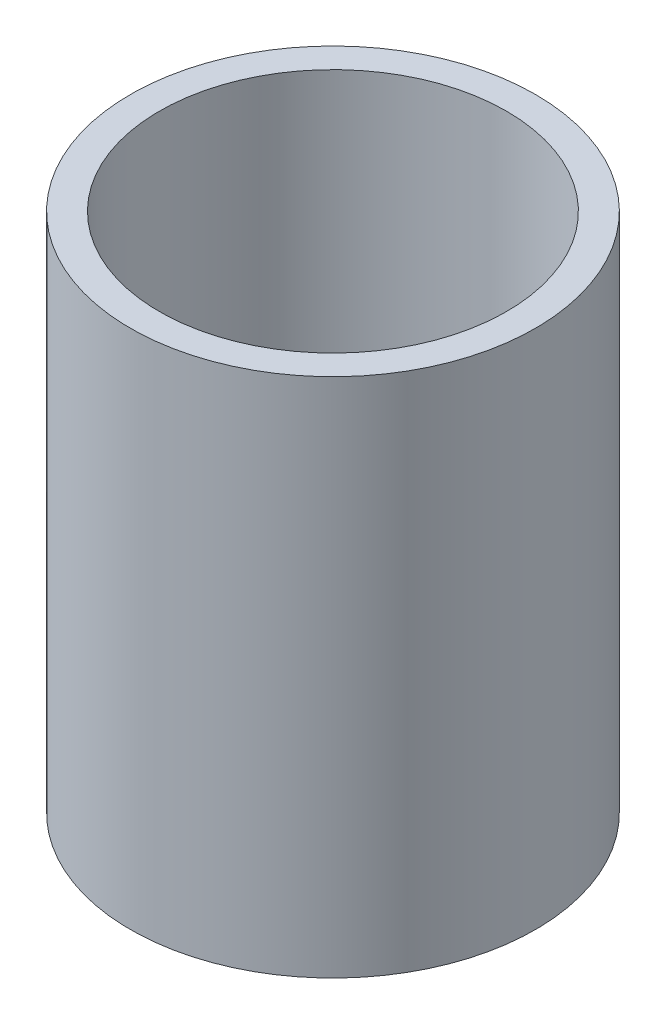
from build123d import *

# Parameters (mm, degrees)
SKETCH1_R           = 17.5
SKETCH1_R_2         = 15
BOSS_EXTRUDE1_DEPTH = 45


with BuildPart() as part:
    # Sketch1 → Boss-Extrude1 (new body)
    with BuildSketch(Plane(origin=(0, 0, 0), x_dir=(1, 0, 0), z_dir=(0, 1, 0))):
        with Locations((0, 0.545038043)):
            Circle(SKETCH1_R)
        with Locations((0, 0.545038043)):
            Circle(SKETCH1_R_2, mode=Mode.SUBTRACT)
    extrude(amount=BOSS_EXTRUDE1_DEPTH)


solid = part.part
